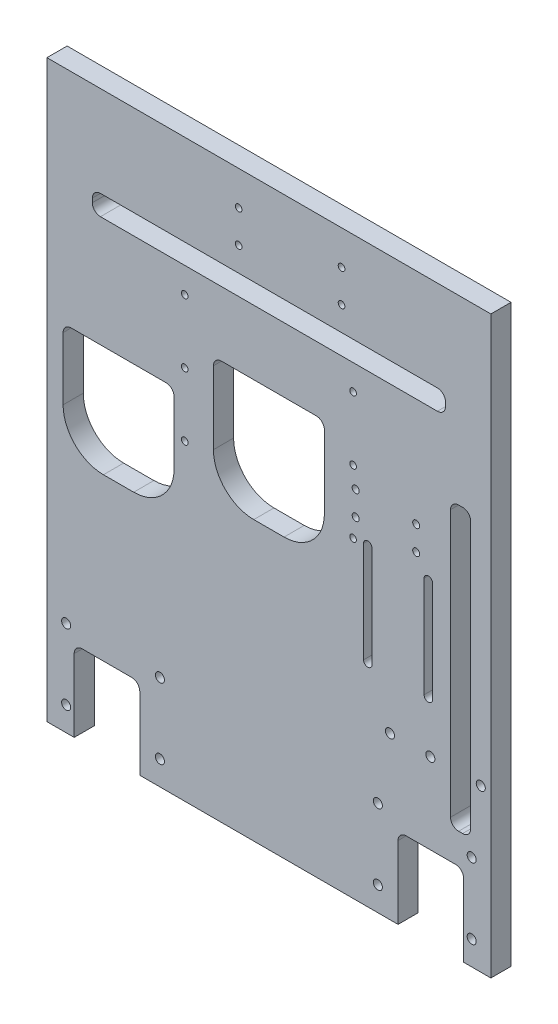
from build123d import *

# Parameters (mm, degrees)
ESQUISSE1_W                  = 220
ESQUISSE1_H                  = 285
BOSS_EXTRU_1_DEPTH           = 10
ESQUISSE2_R                  = 2
ENL_V_MAT_EXTRU_1_DEPTH      = 8
ENL_V_MAT_EXTRU_2_DEPTH      = 361.173569269
ENL_V_MAT_EXTRU_2_DEPTH_BACK = 361.173569269
ESQUISSE3_W                  = 55
ESQUISSE3_H                  = 60
ESQUISSE3_H_2                = 55
ESQUISSE3_W_2                = 10
ESQUISSE3_H_3                = 140
ENL_V_MAT_EXTRU_3_DEPTH      = 361.173569269
ENL_V_MAT_EXTRU_3_DEPTH_BACK = 361.173569269
ESQUISSE5_W                  = 175
ESQUISSE5_H                  = 10
ENL_V_MAT_EXTRU_4_DEPTH      = 361.173569269
ENL_V_MAT_EXTRU_4_DEPTH_BACK = 361.173569269
ESQUISSE6_R                  = 2.25
ESQUISSE6_R_2                = 1.75
ENL_V_MAT_EXTRU_5_DEPTH      = 361.173569269
ENL_V_MAT_EXTRU_5_DEPTH_BACK = 361.173569269
ESQUISSE7_R                  = 1.65
ENL_V_MAT_EXTRU_6_DEPTH      = 361.173569269
ENL_V_MAT_EXTRU_6_DEPTH_BACK = 361.173569269
ESQUISSE8_W                  = 32.5
ESQUISSE8_H                  = 40
CONG_1_R                     = 20
CONG_2_R                     = 4
ENL_V_MAT_EXTRU_7_DEPTH      = 361.173569269
ENL_V_MAT_EXTRU_7_DEPTH_BACK = 361.173569269
ENL_V_MAT_EXTRU_8_DEPTH      = 361.173569269
ENL_V_MAT_EXTRU_8_DEPTH_BACK = 361.173569269
ESQUISSE10_R                 = 2.25


with BuildPart() as part:
    # Esquisse1 → Boss.-Extru.1 (new body)
    with BuildSketch(Plane.XY):
        with Locations((110, 142.5)):
            Rectangle(ESQUISSE1_W, ESQUISSE1_H)
    extrude(amount=BOSS_EXTRU_1_DEPTH)

    # Esquisse2 → Enlèv. mat.-Extru.1 (cut)
    with BuildSketch(Plane.XZ):
        with Locations((110, 5)):
            Circle(ESQUISSE2_R)
        with Locations((213, 5)):
            Circle(ESQUISSE2_R)
        with Locations((7, 5)):
            Circle(ESQUISSE2_R)
    extrude(amount=-ENL_V_MAT_EXTRU_1_DEPTH, mode=Mode.SUBTRACT)

    # Esquisse3 → Enlèv. mat.-Extru.2 (cut, two sides: drawn at the far end of the back side and taken through both)
    with BuildSketch(Plane.XY.offset(10).offset(-ENL_V_MAT_EXTRU_2_DEPTH_BACK)):
        with Locations((110, 168)):
            Rectangle(ESQUISSE3_W, ESQUISSE3_H)
        with Locations((35.5, 147.5)):
            Rectangle(ESQUISSE3_W, ESQUISSE3_H_2)
        with Locations((205, 125)):
            Rectangle(ESQUISSE3_W_2, ESQUISSE3_H_3)
    extrude(amount=ENL_V_MAT_EXTRU_2_DEPTH + ENL_V_MAT_EXTRU_2_DEPTH_BACK, mode=Mode.SUBTRACT)

    # Esquisse5 → Enlèv. mat.-Extru.3 (cut, two sides: drawn at the far end of the back side and taken through both)
    with BuildSketch(Plane.XY.offset(10).offset(-ENL_V_MAT_EXTRU_3_DEPTH_BACK)):
        with Locations((110, 235)):
            Rectangle(ESQUISSE5_W, ESQUISSE5_H)
    extrude(amount=ENL_V_MAT_EXTRU_3_DEPTH + ENL_V_MAT_EXTRU_3_DEPTH_BACK, mode=Mode.SUBTRACT)

    # Esquisse6 → Enlèv. mat.-Extru.4 (cut, two sides: drawn at the far end of the back side and taken through both)
    with BuildSketch(Plane.XY.offset(10).offset(-ENL_V_MAT_EXTRU_4_DEPTH_BACK)):
        with Locations((190, 80)):
            Circle(ESQUISSE6_R)
        with Locations((170, 80)):
            Circle(ESQUISSE6_R)
        with Locations((215, 80)):
            Circle(ESQUISSE6_R)
        with Locations((153, 176.25)):
            Circle(ESQUISSE6_R_2)
        with Locations((183, 176.25)):
            Circle(ESQUISSE6_R_2)
        with Locations((183, 164.25)):
            Circle(ESQUISSE6_R_2)
        with Locations((153, 164.25)):
            Circle(ESQUISSE6_R_2)
    extrude(amount=ENL_V_MAT_EXTRU_4_DEPTH + ENL_V_MAT_EXTRU_4_DEPTH_BACK, mode=Mode.SUBTRACT)

    # Esquisse7 → Enlèv. mat.-Extru.5 (cut, two sides: drawn at the far end of the back side and taken through both)
    with BuildSketch(Plane.XY.offset(10).offset(-ENL_V_MAT_EXTRU_5_DEPTH_BACK)):
        with Locations((68.285, 217.4)):
            Circle(ESQUISSE7_R)
        with Locations((68.285, 186)):
            Circle(ESQUISSE7_R)
        with Locations((68.285, 154.6)):
            Circle(ESQUISSE7_R)
        with Locations((151.715, 154.6)):
            Circle(ESQUISSE7_R)
        with Locations((151.715, 186)):
            Circle(ESQUISSE7_R)
        with Locations((151.715, 217.4)):
            Circle(ESQUISSE7_R)
        with Locations((95, 268)):
            Circle(ESQUISSE7_R)
        with Locations((146, 268)):
            Circle(ESQUISSE7_R)
        with Locations((146, 252)):
            Circle(ESQUISSE7_R)
        with Locations((95, 252)):
            Circle(ESQUISSE7_R)
    extrude(amount=ENL_V_MAT_EXTRU_5_DEPTH + ENL_V_MAT_EXTRU_5_DEPTH_BACK, mode=Mode.SUBTRACT)

    # Esquisse8 → Enlèv. mat.-Extru.6 (cut, two sides: drawn at the far end of the back side and taken through both)
    with BuildSketch(Plane.XY.offset(10).offset(-ENL_V_MAT_EXTRU_6_DEPTH_BACK)):
        with Locations((190.25, 20)):
            Rectangle(ESQUISSE8_W, ESQUISSE8_H)
        with Locations((29.75, 20)):
            Rectangle(ESQUISSE8_W, ESQUISSE8_H)
    extrude(amount=ENL_V_MAT_EXTRU_6_DEPTH + ENL_V_MAT_EXTRU_6_DEPTH_BACK, mode=Mode.SUBTRACT)

    # Congé1
    cong_1_edges = [part.edges().sort_by_distance(p)[0] for p in [
        (137.5, 138, 5),
        (82.5, 138, 5),
        (63, 120, 5),
        (8, 120, 5),
    ]]
    fillet(cong_1_edges, radius=CONG_1_R)

    # Congé2
    cong_2_edges = [part.edges().sort_by_distance(p)[0] for p in [
        (137.5, 198, 5),
        (82.5, 198, 5),
        (197.5, 230, 5),
        (197.5, 240, 5),
        (22.5, 240, 5),
        (22.5, 230, 5),
        (63, 175, 5),
        (8, 175, 5),
        (200, 195, 5),
        (210, 195, 5),
        (210, 55, 5),
        (200, 55, 5),
        (206.5, 40, 5),
        (174, 40, 5),
        (46, 40, 5),
        (13.5, 40, 5),
    ]]
    fillet(cong_2_edges, radius=CONG_2_R)

    # Esquisse9 → Enlèv. mat.-Extru.7 (cut, two sides: drawn at the far end of the back side and taken through both)
    with BuildSketch(Plane.XY.offset(10).offset(-ENL_V_MAT_EXTRU_7_DEPTH_BACK)):
        with BuildLine():
            Line((191.1, 155), (191.1, 105))
            ThreePointArc((191.1, 105), (189, 102.9), (186.9, 105))
            Line((186.9, 105), (186.9, 155))
            ThreePointArc((186.9, 155), (189, 157.1), (191.1, 155))
        make_face()
        with BuildLine():
            Line((156.9, 105), (156.9, 155))
            ThreePointArc((156.9, 155), (159, 157.1), (161.1, 155))
            Line((161.1, 155), (161.1, 105))
            ThreePointArc((161.1, 105), (159, 102.9), (156.9, 105))
        make_face()
    extrude(amount=ENL_V_MAT_EXTRU_7_DEPTH + ENL_V_MAT_EXTRU_7_DEPTH_BACK, mode=Mode.SUBTRACT)

    # Esquisse10 → Enlèv. mat.-Extru.8 (cut, two sides: drawn at the far end of the back side and taken through both)
    with BuildSketch(Plane.XY.offset(10).offset(-ENL_V_MAT_EXTRU_8_DEPTH_BACK)):
        with Locations((9.5, 12)):
            Circle(ESQUISSE10_R)
        with Locations((9.5, 47)):
            Circle(ESQUISSE10_R)
        with Locations((210.5, 47)):
            Circle(ESQUISSE10_R)
        with Locations((210.5, 12)):
            Circle(ESQUISSE10_R)
        with Locations((56, 47)):
            Circle(ESQUISSE10_R)
        with Locations((56, 12)):
            Circle(ESQUISSE10_R)
        with Locations((164, 12)):
            Circle(ESQUISSE10_R)
        with Locations((164, 47)):
            Circle(ESQUISSE10_R)
    extrude(amount=ENL_V_MAT_EXTRU_8_DEPTH + ENL_V_MAT_EXTRU_8_DEPTH_BACK, mode=Mode.SUBTRACT)


solid = part.part
